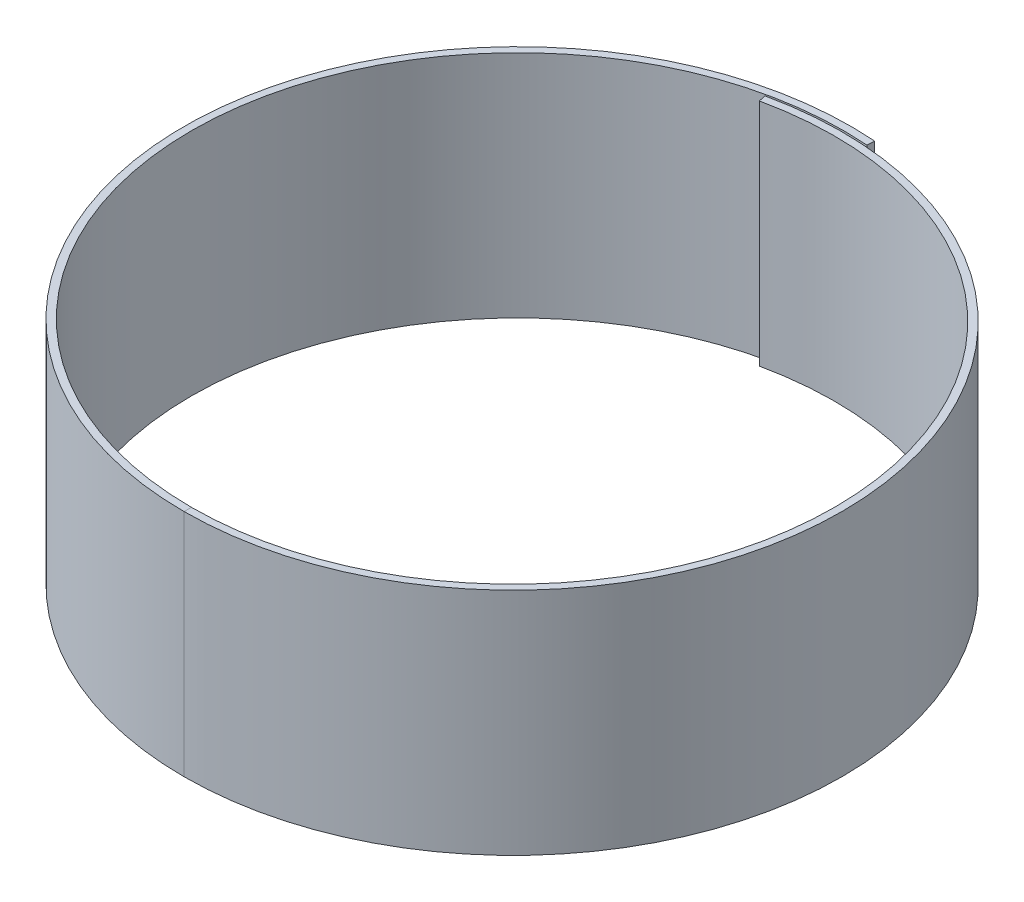
from build123d import *

# Parameters (mm, degrees)
BASE_FLANGE1_DEPTH = 25


# Sheet-metal steps are written as plain solids
with BuildPart() as part:
    # Sketch1 → Base-Flange1 (new body)
    with BuildSketch(Plane(origin=(0, 0, 0), x_dir=(1, 0, 0), z_dir=(0, 1, 0))):
        with BuildLine():
            ThreePointArc((2.605767321, 35.404236705), (-35.476051098, 1.303763201), (0, -35.5))
            ThreePointArc((0, -35.5), (34.801944096, 3.21815642), (-7.394232679, 33.710017876))
            Line((-7.394232679, 33.710017876), (-7.563243712, 34.491961142))
            ThreePointArc((-7.563243712, 34.491961142), (35.597417103, 3.303142853), (0, -36.3))
            ThreePointArc((0, -36.3), (-36.275511405, 1.33314378), (2.664488838, 36.202078659))
            Line((2.664488838, 36.202078659), (2.605767321, 35.404236705))
        make_face()
    extrude(amount=BASE_FLANGE1_DEPTH)


solid = part.part
